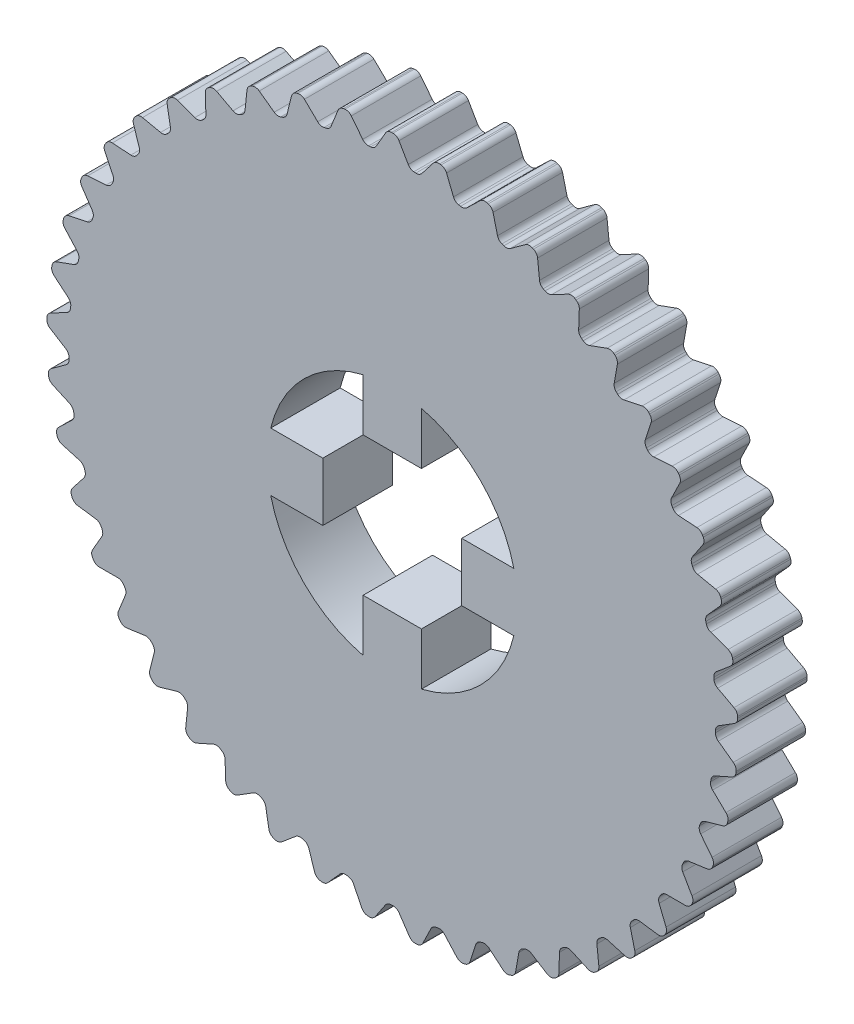
from build123d import *

# Parameters (mm, degrees)
BOSS_EXTRUDE1_DEPTH      = 3.175
SKETCH6_R                = 14.785460590196006
BOSS_EXTRUDE2_DEPTH      = 3.175
FILLET1_R                = 0.3175
CIRPATTERN3_COUNT        = 45
FILLET1_OF_CIRPATTERN3_R = 0.3175
CUT_EXTRUDE1_DEPTH       = 3.175


with BuildPart() as part:
    # Sketch1 → Boss-Extrude1 (new body)
    with BuildSketch(Plane.XY):
        with BuildLine():
            Line((0.21589999999999998, 15.80146059019601), (-0.21589999999999998, 15.80146059019601))
            Line((-0.21589999999999998, 15.80146059019601), (-0.8154815934548094, 14.762954807049152))
            ThreePointArc((-0.8154815934548094, 14.762954807049152), (-0.9234563030247666, 14.756594231754258), (-1.0313815934548094, 14.74944395131294))
            ThreePointArc((-1.0313815934548094, 14.74944395131294), (6e-17, 13.753450323970997), (1.0313815934548094, 14.74944395131294))
            ThreePointArc((1.0313815934548094, 14.74944395131294), (0.9234563030247651, 14.756594231754258), (0.8154815934548094, 14.762954807049152))
            Line((0.8154815934548094, 14.762954807049152), (0.21589999999999998, 15.80146059019601))
        make_face()
    boss_extrude1 = extrude(amount=BOSS_EXTRUDE1_DEPTH)

    # Sketch6 → Boss-Extrude2 (add)
    with BuildSketch(Plane.XY):
        Circle(SKETCH6_R)
    extrude(amount=BOSS_EXTRUDE2_DEPTH)

    # Fillet1
    fillet1_edges = [part.edges().sort_by_distance(p)[0] for p in [
        (-0.8154815934548094, 14.76295480704915, 1.5875),
        (0.8154815934548095, 14.762954807049152, 1.5875),
        (0.21589999999999998, 15.80146059019601, 1.5875),
        (-0.21589999999999998, 15.80146059019601, 1.5875),
    ]]
    fillet(fillet1_edges, radius=FILLET1_R)

    # CirPattern3: Boss-Extrude1 ×45 about axis
    cirpattern3_axis = Axis((0, 0, 3.175), (0, 0, 1))
    for i in range(1, CIRPATTERN3_COUNT):
        add(boss_extrude1.rotate(cirpattern3_axis, i * 360 / CIRPATTERN3_COUNT))

    # Fillet1 of CirPattern3
    fillet1_of_cirpattern3_edges = [part.edges().sort_by_distance(p)[0] for p in [
        (-2.862151582475127, 14.505789643558682, 1.5875),
        (-1.2470608171855424, 14.732775847832608, 1.5875),
        (-1.9853393939945394, 15.677729334446715, 1.5875),
        (-2.4129371460771494, 15.617634389452158, 1.5875),
        (-4.853113046591737, 13.966285784747507, 1.5875),
        (-3.2853306075300326, 14.415840165022141, 1.5875),
        (-4.147936414975064, 15.248848910355216, 1.5875),
        (-4.56300921528123, 15.129828700113437, 1.5875),
        (-6.74961418559071, 13.154944059550836, 1.5875),
        (-5.259655174607128, 13.818316551174666, 1.5875),
        (-6.22979857184584, 14.5231669875322, 1.5875),
        (-6.6242675004559155, 14.34753810505207, 1.5875),
        (-8.5147417620395, 12.087556311762095, 1.5875),
        (-7.131606536479581, 12.951835123760684, 1.5875),
        (-8.19040478580648, 13.51480813915447, 1.5875),
        (-8.556591953726825, 13.285989000858573, 1.5875),
        (-10.114139575465394, 10.78489802975642, 1.5875),
        (-8.864749289201661, 11.833260958156796, 1.5875),
        (-9.991594087058758, 12.243398923214505, 1.5875),
        (-10.322372077597532, 11.965843233351857, 1.5875),
        (-11.516677166718104, 9.272323975241218, 1.5875),
        (-10.425349780512295, 10.484365828137221, 1.5875),
        (-11.59830837467626, 10.733685873894027, 1.5875),
        (-11.887238970502013, 10.41279593825289, 1.5875),
        (-12.695055736946758, 7.57927468166014, 1.5875),
        (-11.783032697004867, 8.931404443062327, 1.5875),
        (-12.979274782660923, 9.01505383842492, 1.5875),
        (-13.220734278379592, 8.657075414595655, 1.5875),
        (-13.626339487667614, 5.738703427697719, 1.5875),
        (-12.911372285051277, 7.204603429825201, 1.5875),
        (-14.107614370707333, 7.1209540344626285, 1.5875),
        (-14.296903031890858, 6.732854765270647, 1.5875),
        (-14.292402039992453, 3.7864348391935585, 1.5875),
        (-13.788406698037457, 5.337573005941463, 1.5875),
        (-14.961365292201428, 5.088252960184677, 1.5875),
        (-15.094798830372529, 4.677586756448431, 1.5875),
        (-14.680279243975201, 1.760467603550289, 1.5875),
        (-14.397065458726498, 3.3666527948963814, 1.5875),
        (-15.5239102565836, 2.9565148298386914, 1.5875),
        (-15.598891539700181, 2.5312748420880204, 1.5875),
        (-14.782421511044111, -0.29976513149386763, 1.5875),
        (-14.725501716680661, 1.3302045167094363, 1.5875),
        (-15.78429996600757, 0.7672315013156692, 1.5875),
        (-15.799369568683709, 0.3356945422088236, 1.5875),
        (-14.596840758155794, -2.354163279231283, 1.5875),
        (-14.767322833729573, -0.7321346793100499, 1.5875),
        (-15.737466230968296, -1.4369851156675688, 1.5875),
        (-15.692330840529324, -1.866419670087589, 1.5875),
        (-14.127149103570241, -4.362740316559499, 1.5875),
        (-14.521714809400695, -2.780223706587617, 1.5875),
        (-15.384320616845743, -3.613232451920676, 1.5875),
        (-15.279858742325805, -4.032206146526652, 1.5875),
        (-13.38248856107763, -6.286401576169442, 1.5875000000000001),
        (-13.993458124512602, -4.77419884187405, 1.5875000000000001),
        (-14.731736701321616, -5.7191523284881445, 1.5875000000000001),
        (-14.569981574284625, -6.119510316890084, 1.5875000000000001),
        (-12.377353101098755, -8.08770517977505, 1.5875),
        (-13.192834694553566, -6.675249627274093, 1.5875),
        (-13.792416288008395, -7.713755410420941, 1.5875),
        (-13.576516288008394, -8.087705179775062, 1.5875),
        (-11.131306542037473, -9.731590801684632, 1.5875000000000001),
        (-12.135427743892087, -8.446374271663165, 1.5875000000000001),
        (-12.584642180290086, -9.558219017556631, 1.5875000000000001),
        (-12.318799555244468, -9.898482060964014, 1.5875000000000001),
        (-9.668601762808953, -11.18606207815989, 1.5875000000000001),
        (-10.841818496040212, -10.053099848462644, 1.5875000000000001),
        (-11.131922327350738, -11.216642763828565, 1.5875000000000001),
        (-10.82131140156451, -11.51659624819276, 1.5875000000000001),
        (-8.017708648138862, -12.422809380240787, 1.5875),
        (-9.337185583548669, -11.464153271943381, 1.5875),
        (-9.462532268683486, -12.656747317444612, 1.5875),
        (-9.113198730512384, -12.910552989384502, 1.5875),
        (-6.210759954641156, -13.417760828471529, 1.5875),
        (-7.650814974564529, -12.652069992266815, 1.5875),
        (-7.6089647828772256, -13.850502681363293, 1.5875),
        (-7.227708012280741, -14.05322050217424, 1.5875),
        (-4.282925883261104, -14.151550824652798, 1.5875),
        (-5.815529954773542, -13.593728561707083, 1.5875),
        (-5.607297452641426, -14.774673765302522, 1.5875),
        (-5.20153817898607, -14.922358063190545, 1.5875),
        (-2.271729531319354, -14.609896981182679, 1.5875),
        (-3.8670522594801593, -14.27080066733078, 1.5875),
        (-3.49649045569627, -15.411272630342458, 1.5875),
        (-3.074126321699413, -15.501048898437565, 1.5875),
        (-0.2163165481045206, -14.783878111485338, 1.5875),
        (-1.843306790662751, -14.670107870760045, 1.5875),
        (-1.3176282492299383, -15.747908603695567, 1.5875),
        (-0.8868800923277462, -15.77802944905828, 1.5875),
        (1.8433067906627472, -14.670107870760043, 1.5875),
        (0.21631654810451695, -14.78387811148534, 1.5875),
        (0.8868800923277422, -15.77802944905828, 1.5875),
        (1.3176282492299343, -15.747908603695567, 1.5875),
        (3.867052259480162, -14.270800667330777, 1.5875),
        (2.271729531319357, -14.609896981182679, 1.5875),
        (3.074126321699416, -15.501048898437565, 1.5875),
        (3.4964904556962733, -15.411272630342458, 1.5875),
        (5.815529954773538, -13.593728561707083, 1.5875),
        (4.282925883261101, -14.151550824652801, 1.5875),
        (5.201538178986066, -14.922358063190547, 1.5875),
        (5.607297452641422, -14.774673765302524, 1.5875),
        (7.650814974564531, -12.652069992266812, 1.5875),
        (6.2107599546411585, -13.417760828471529, 1.5875),
        (7.227708012280743, -14.053220502174238, 1.5875),
        (7.608964782877228, -13.850502681363292, 1.5875),
        (9.337185583548665, -11.464153271943385, 1.5875000000000001),
        (8.01770864813886, -12.422809380240793, 1.5875000000000001),
        (9.11319873051238, -12.910552989384506, 1.5875000000000001),
        (9.462532268683482, -12.656747317444616, 1.5875000000000001),
        (10.841818496040212, -10.05309984846264, 1.5875),
        (9.668601762808956, -11.18606207815989, 1.5875),
        (10.821311401564513, -11.516596248192759, 1.5875),
        (11.131922327350741, -11.216642763828563, 1.5875),
        (12.135427743892087, -8.446374271663162, 1.5875),
        (11.131306542037477, -9.73159080168463, 1.5875),
        (12.31879955524447, -9.89848206096401, 1.5875),
        (12.584642180290087, -9.558219017556628, 1.5875),
        (13.19283469455356, -6.675249627274103, 1.5875),
        (12.377353101098752, -8.08770517977506, 1.5875),
        (13.576516288008388, -8.087705179775073, 1.5875),
        (13.79241628800839, -7.713755410420952, 1.5875),
        (13.993458124512598, -4.774198841874052, 1.5875),
        (13.38248856107763, -6.286401576169446, 1.5875),
        (14.569981574284624, -6.1195103168900875, 1.5875),
        (14.731736701321614, -5.719152328488148, 1.5875),
        (14.521714809400693, -2.780223706587617, 1.5875),
        (14.127149103570243, -4.3627403165595, 1.5875),
        (15.279858742325805, -4.032206146526652, 1.5875),
        (15.384320616845743, -3.613232451920676, 1.5875),
        (14.76732283372957, -0.7321346793100468, 1.5875),
        (14.596840758155796, -2.3541632792312805, 1.5875),
        (15.692330840529326, -1.866419670087586, 1.5875),
        (15.737466230968298, -1.4369851156675657, 1.5875),
        (14.72550171668066, 1.3302045167094392, 1.5875),
        (14.782421511044113, -0.29976513149386474, 1.5875),
        (15.799369568683709, 0.33569454220882683, 1.5875),
        (15.78429996600757, 0.7672315013156723, 1.5875),
        (14.397065458726498, 3.3666527948963747, 1.5875),
        (14.680279243975205, 1.7604676035502829, 1.5875),
        (15.598891539700183, 2.531274842088013, 1.5875),
        (15.523910256583601, 2.9565148298386847, 1.5875),
        (13.788406698037457, 5.33757300594146, 1.5875),
        (14.292402039992457, 3.7864348391935554, 1.5875),
        (15.09479883037253, 4.677586756448427, 1.5875),
        (14.96136529220143, 5.088252960184674, 1.5875),
        (12.911372285051275, 7.2046034298252, 1.5875),
        (13.626339487667616, 5.738703427697718, 1.5875),
        (14.296903031890858, 6.7328547652706465, 1.5875),
        (14.107614370707333, 7.120954034462628, 1.5875),
        (11.783032697004863, 8.931404443062329, 1.5875),
        (12.695055736946758, 7.579274681660143, 1.5875),
        (13.22073427837959, 8.657075414595658, 1.5875),
        (12.979274782660921, 9.015053838424924, 1.5875),
        (10.425349780512299, 10.484365828137214, 1.5875),
        (11.51667716671811, 9.27232397524121, 1.5875),
        (11.887238970502018, 10.412795938252883, 1.5875),
        (11.598308374676265, 10.73368587389402, 1.5875),
        (8.864749289201665, 11.83326095815679, 1.5875),
        (10.1141395754654, 10.784898029756416, 1.5875),
        (10.322372077597537, 11.965843233351853, 1.5875),
        (9.991594087058763, 12.243398923214501, 1.5875),
        (7.131606536479582, 12.951835123760683, 1.5875),
        (8.514741762039503, 12.087556311762096, 1.5875),
        (8.556591953726826, 13.285989000858573, 1.5875),
        (8.190404785806482, 13.51480813915447, 1.5875),
        (5.2596551746071265, 13.818316551174666, 1.5875),
        (6.74961418559071, 13.15494405955084, 1.5875),
        (6.624267500455915, 14.347538105052072, 1.5875),
        (6.229798571845839, 14.523166987532202, 1.5875),
        (3.285330607530029, 14.415840165022141, 1.5875),
        (4.8531130465917345, 13.966285784747507, 1.5875),
        (4.563009215281227, 15.129828700113437, 1.5875),
        (4.14793641497506, 15.248848910355216, 1.5875),
        (1.2470608171855488, 14.732775847832604, 1.5875),
        (2.862151582475134, 14.505789643558682, 1.5875),
        (2.4129371460771565, 15.617634389452157, 1.5875),
        (1.9853393939945465, 15.677729334446713, 1.5875),
    ]]
    fillet(fillet1_of_cirpattern3_edges, radius=FILLET1_OF_CIRPATTERN3_R)

    # Sketch7 → Cut-Extrude1 (cut)
    with BuildSketch(Plane.XY.offset(3.175)):
        with BuildLine():
            Line((-1.3334999999999995, 3.175), (-1.3334999999999995, 5.5572477675555))
            ThreePointArc((-1.3334999999998824, 5.5572477675554754), (-4.041115254481156, 4.041115254481082), (-5.5572477675555, 1.3334999999997799))
            Line((-5.557247767555547, 1.3335000000000006), (-3.175, 1.3335000000000004))
            Line((-3.175, 1.3334999999999995), (-3.175, -1.3334999999999995))
            Line((-3.175, -1.3335000000000004), (-5.557247767555547, -1.3335000000000006))
            ThreePointArc((-5.5572477675555, -1.3334999999997783), (-4.0411152544811575, -4.04111525448108), (-1.3334999999998838, -5.557247767555475))
            Line((-1.3334999999999995, -5.5572477675555), (-1.3334999999999995, -3.1750000000000007))
            Line((-1.3334999999999984, -3.175), (1.3334999999999984, -3.175))
            Line((1.3335000000000001, -3.1750000000000007), (1.3335000000000001, -5.557247767555417))
            ThreePointArc((1.3335000000000643, -5.557247767555432), (4.041115254481104, -4.041115254481134), (5.557247767555421, -1.3335000000001063))
            Line((5.557247767555399, -1.3335), (3.174999999999999, -1.3335000000000001))
            Line((3.1749999999999994, -1.3334999999999995), (3.1749999999999994, 1.3334999999999995))
            Line((3.174999999999999, 1.3335000000000001), (5.557247767555399, 1.3335))
            ThreePointArc((5.557247767555421, 1.3335000000001056), (4.041115254481104, 4.0411152544811335), (1.3335000000000643, 5.557247767555432))
            Line((1.3335000000000004, 5.557247767555418), (1.3335000000000004, 3.175))
            Line((1.3334999999999992, 3.175), (-1.3334999999999992, 3.175))
        make_face()
    extrude(amount=-CUT_EXTRUDE1_DEPTH, mode=Mode.SUBTRACT)


solid = part.part
